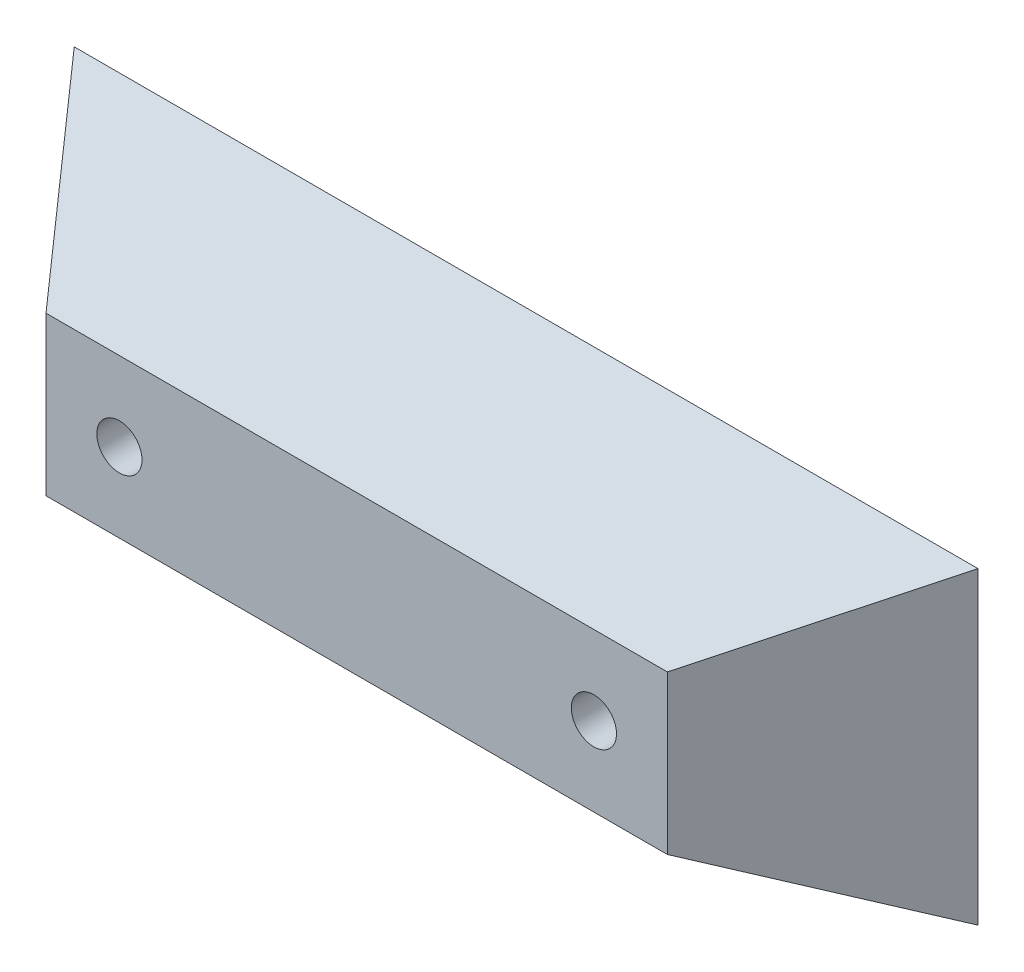
from build123d import *

# Parameters (mm, degrees)
DODANIE_WYCI_GNI_CIE1_DEPTH = 30
WYTNIJ_WYCI_GNI_CIE1_REACH  = 54.202
SZKIC2_R                    = 2
SFAZOWANIE1_SIZE            = 8
SFAZOWANIE1_SIZE_2          = 18
SFAZOWANIE2_SIZE            = 8
SFAZOWANIE2_SIZE_2          = 18


with BuildPart() as part:
    # Szkic1 → Dodanie-wyciągnięcie1 (new body)
    with BuildSketch(Plane(origin=(0, 0, 0), x_dir=(1, 0, 0), z_dir=(0, 1, 0))):
        Polygon((-40, 0), (-27.5, -15), (27.5, -15), (40, 0), align=None)
    extrude(amount=DODANIE_WYCI_GNI_CIE1_DEPTH)

    # Szkic2 → Wytnij-wyciągnięcie1 (cut, up to next)
    with BuildSketch(Plane(origin=(0, 0, 0), x_dir=(-1, 0, 0), z_dir=(0, 0, -1)), mode=Mode.PRIVATE) as wytnij_wyci_gni_cie1_sk1:
        with Locations((-21, 15)):
            Circle(SZKIC2_R)
    wytnij_wyci_gni_cie1_tool1 = extrude(wytnij_wyci_gni_cie1_sk1.sketch, amount=-WYTNIJ_WYCI_GNI_CIE1_REACH, mode=Mode.PRIVATE) & part.part
    # Szkic2 → Wytnij-wyciągnięcie1 (cut, up to next)
    with BuildSketch(Plane(origin=(0, 0, 0), x_dir=(-1, 0, 0), z_dir=(0, 0, -1)), mode=Mode.PRIVATE) as wytnij_wyci_gni_cie1_sk2:
        with Locations((21, 15)):
            Circle(SZKIC2_R)
    wytnij_wyci_gni_cie1_tool2 = extrude(wytnij_wyci_gni_cie1_sk2.sketch, amount=-WYTNIJ_WYCI_GNI_CIE1_REACH, mode=Mode.PRIVATE) & part.part
    add(wytnij_wyci_gni_cie1_tool1.solids().sort_by_distance((21, 15, 0))[0], mode=Mode.SUBTRACT)
    add(wytnij_wyci_gni_cie1_tool2.solids().sort_by_distance((-21, 15, 0))[0], mode=Mode.SUBTRACT)

    # Sfazowanie1
    # the kernel refuses this chamfer: 18, 8 mm, written as the material it takes off along each edge
    with BuildSketch(Plane(origin=(-74.15058918, 0, 15), x_dir=(0, 0.996867139056945, 0.0790942922619672), z_dir=(1, 0, 0))) as sfazowanie1_piece_1:
        Polygon((SFAZOWANIE1_SIZE * 0.996867139057, -SFAZOWANIE1_SIZE * 0.079094292262), (-SFAZOWANIE1_SIZE_2 * 0.079094292262, -SFAZOWANIE1_SIZE_2 * 0.996867139057), (0, 0), align=None)
    extrude(amount=148.301178361, mode=Mode.SUBTRACT)

    # Sfazowanie2
    # the kernel refuses this chamfer: 18, 8 mm, written as the material it takes off along each edge
    with BuildSketch(Plane(origin=(-74.15058918, 30, 15), x_dir=(0, -0.996867139056945, 0.0790942922619672), z_dir=(1, 0, 0))) as sfazowanie2_piece_1:
        Polygon((SFAZOWANIE2_SIZE * 0.996867139057, SFAZOWANIE2_SIZE * 0.079094292262), (-SFAZOWANIE2_SIZE_2 * 0.079094292262, SFAZOWANIE2_SIZE_2 * 0.996867139057), (0, 0), align=None)
    extrude(amount=148.301178361, mode=Mode.SUBTRACT)


solid = part.part
